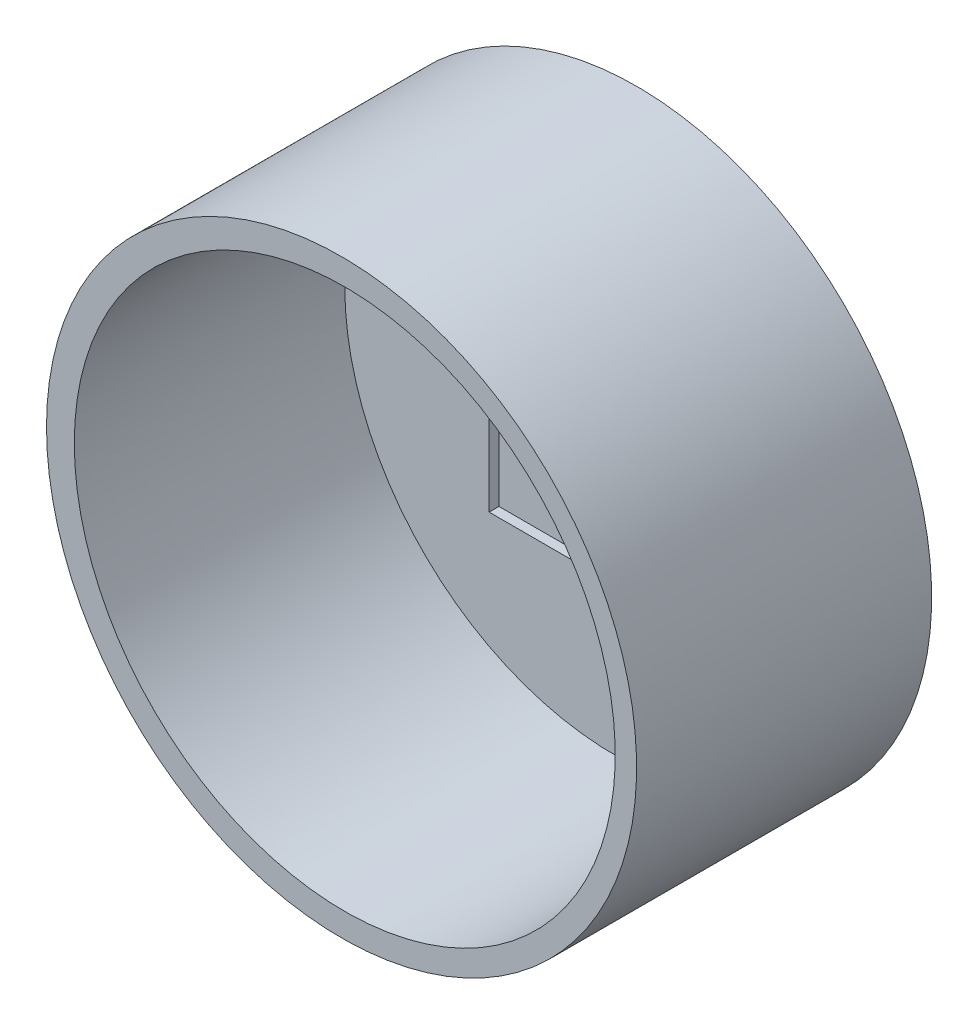
from build123d import *

# Parameters (mm, degrees)
SKETCH1_R           = 76.2
SKETCH1_R_2         = 69.85
BOSS_EXTRUDE1_DEPTH = 76.2
SKETCH3_R           = 76.2
BOSS_EXTRUDE2_DEPTH = 6.35
SKETCH4_W           = 63.5
SKETCH4_H           = 63.5
CUT_EXTRUDE1_DEPTH  = 2.54
SKETCH5_R           = 2.54
CUT_EXTRUDE2_DEPTH  = 129.420802443


with BuildPart() as part:
    # Sketch1 → Boss-Extrude1 (new body)
    with BuildSketch(Plane.XY):
        Circle(SKETCH1_R)
        with Locations((0.828825483, 0)):
            Circle(SKETCH1_R_2, mode=Mode.SUBTRACT)
    extrude(amount=BOSS_EXTRUDE1_DEPTH)

    # Sketch3 → Boss-Extrude2 (add)
    with BuildSketch(Plane.XY):
        Circle(SKETCH3_R)
    extrude(amount=BOSS_EXTRUDE2_DEPTH)

    # Sketch4 → Cut-Extrude1 (cut)
    with BuildSketch(Plane.XY.offset(6.35)):
        Rectangle(SKETCH4_W, SKETCH4_H)
    extrude(amount=-CUT_EXTRUDE1_DEPTH, mode=Mode.SUBTRACT)

    # Sketch5 → Cut-Extrude2 (cut, through all)
    with BuildSketch(Plane.XY.offset(6.35)):
        with Locations((0, 44.16298)):
            Circle(SKETCH5_R)
        with Locations((44.16298, 0)):
            Circle(SKETCH5_R)
        with Locations((-44.16298, 0)):
            Circle(SKETCH5_R)
        with Locations((0, -44.16298)):
            Circle(SKETCH5_R)
    extrude(amount=-CUT_EXTRUDE2_DEPTH, mode=Mode.SUBTRACT)


solid = part.part
